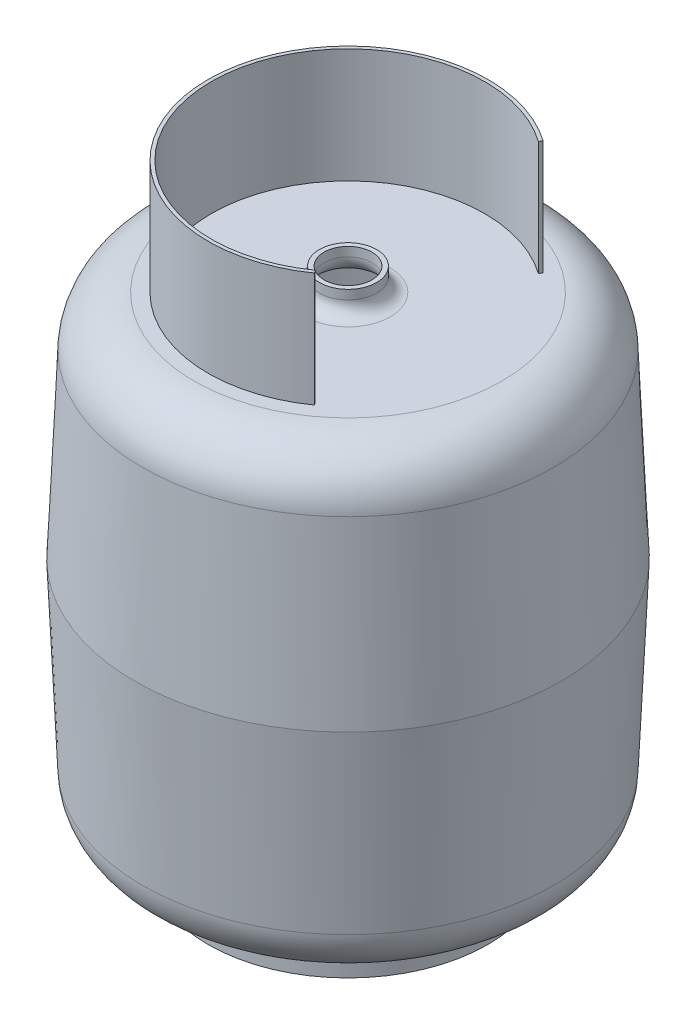
from build123d import *

# Parameters (mm, degrees)
BOSS_EXTRUDE1_DEPTH = 100
BOSS_EXTRUDE2_START = 30
SKETCH3_R           = 122.421871599
SKETCH3_R_2         = 119.421871599
BOSS_EXTRUDE2_DEPTH = 30


# Read off the part's stored shape, not the designer's step: Shell1
with BuildPart() as part:
    # Sketch1 → Revolve1 (revolve)
    with BuildSketch(Plane.XY, mode=Mode.PRIVATE) as revolve1_sk:
        with BuildLine():
            Line((0, 0), (0, -402.5))
            Line((0, -402.5), (134.421871599, -402.5))
            ThreePointArc((134.421871599, -402.5), (165.539959109, -390.006378293), (179.37904157, -359.462872431))
            Line((179.37904157, -359.462872431), (186.28676476, -201.25))
            Line((186.28676476, -201.25), (179.37904157, -43.037127569))
            ThreePointArc((179.37904157, -43.037127569), (165.539959109, -12.493621707), (134.421871599, 0))
            Line((134.421871599, 0), (37, 0))
            ThreePointArc((37, 0), (28.514718626, 3.514718626), (25, 12))
            Line((25, 12), (25, 20))
            Line((25, 20), (0, 20))
            Line((0, 20), (0, 0))
        make_face()
    revolve(revolve1_sk.sketch.rotate(Axis((0, 0, 0), (0, -1, 0)), 180), axis=Axis((0, 0, 0), (0, -1, 0)))

    # Shell1 outline → Shell1 (revolve, cut)
    with BuildSketch(Plane.XY):
        with BuildLine():
            Line((0, 20), (0, -398.5))
            Line((0, -398.5), (134.421871599, -398.5))
            ThreePointArc((134.421871599, -398.5), (162.773906886, -387.116922444), (175.382848683, -359.288394882))
            Line((175.382848683, -359.288394882), (182.28295402, -201.25))
            Line((182.28295402, -201.25), (175.382848683, -43.211605118))
            ThreePointArc((175.382848683, -43.211605118), (162.773906886, -15.383077556), (134.421871599, -4))
            Line((134.421871599, -4), (37, -4))
            ThreePointArc((37, -4), (25.686291501, 0.686291501), (21, 12))
            Line((21, 12), (21, 20))
            Line((21, 20), (0, 20))
        make_face()
    revolve(axis=Axis((0, 0, 0), (0, 1, 0)), mode=Mode.SUBTRACT)

    # Sketch2 → Boss-Extrude1 (add)
    with BuildSketch(Plane(origin=(0, 0, 0), x_dir=(1, 0, 0), z_dir=(0, 1, 0))):
        with BuildLine():
            Line((68.888945112, 97.549457494), (70.619506127, 100))
            ThreePointArc((70.619506127, 100), (-122.421871599, 0), (70.619506127, -100))
            Line((70.619506127, -100), (68.888945112, -97.549457494))
            ThreePointArc((68.888945112, -97.549457494), (-119.421871599, 0), (68.888945112, 97.549457494))
        make_face()
    extrude(amount=BOSS_EXTRUDE1_DEPTH)

    # Sketch3 → Boss-Extrude2 (add)
    with BuildSketch(Plane.XZ.offset(402.5).offset(BOSS_EXTRUDE2_START)):
        with Locations(Location((0, 0, 0), (0, 0, 180))):
            Circle(SKETCH3_R)
        Circle(SKETCH3_R_2, mode=Mode.SUBTRACT)
    extrude(amount=-BOSS_EXTRUDE2_DEPTH)


solid = part.part
